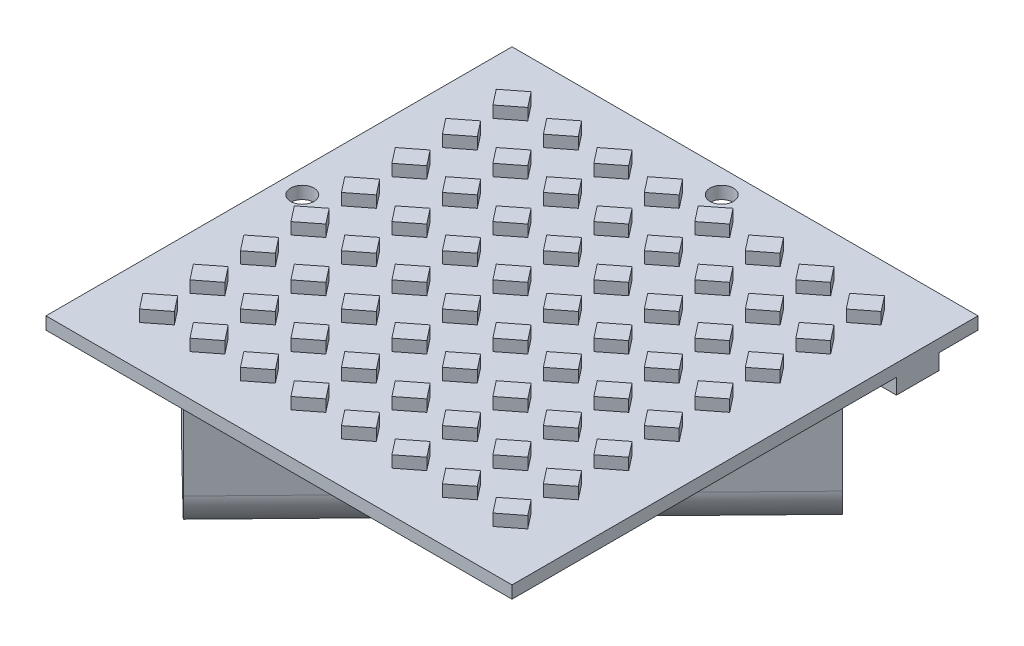
from build123d import *

# Parameters (mm, degrees)
SKETCH1_W           = 60
SKETCH1_H           = 60
BOSS_EXTRUDE1_DEPTH = 1.6
BOSS_EXTRUDE2_DEPTH = 1.5
BOSS_EXTRUDE3_DEPTH = 15
FILLET1_R           = 5
CUT_EXTRUDE1_REACH  = 52.757
SKETCH5_R           = 1.5
SKETCH6_W           = 20
SKETCH6_H           = 17
BOSS_EXTRUDE4_DEPTH = 3.2
SKETCH7_W           = 4
SKETCH7_H           = 5.5
BOSS_EXTRUDE5_DEPTH = 2


with BuildPart() as part:
    # Sketch1 → Boss-Extrude1 (new body)
    with BuildSketch(Plane(origin=(0, 0, 0), x_dir=(1, 0, 0), z_dir=(0, 1, 0))):
        with Locations((-5.537137766, -2.214696793)):
            Rectangle(SKETCH1_W, SKETCH1_H)
    extrude(amount=BOSS_EXTRUDE1_DEPTH)

    # Sketch2 → Boss-Extrude2 (add)
    with BuildSketch(Plane(origin=(0, 1.6, 0), x_dir=(1, 0, 0), z_dir=(0, 1, 0))):
        Polygon((-21.29585382, 22.505364141), (-19.756743715, 20.535303207), (-22.278421711, 18.565242273), (-23.817531816, 20.535303207), align=None)
        Polygon((-30.317531816, 20.535303207), (-27.79585382, 22.505364141), (-26.256743715, 20.535303207), (-28.778421711, 18.565242273), align=None)
        Polygon((-14.79585382, 22.505364141), (-13.256743715, 20.535303207), (-15.778421711, 18.565242273), (-17.317531816, 20.535303207), align=None)
        Polygon((-8.29585382, 22.505364141), (-6.756743715, 20.535303207), (-9.278421711, 18.565242273), (-10.817531816, 20.535303207), align=None)
        Polygon((-1.79585382, 22.505364141), (-0.256743715, 20.535303207), (-2.778421711, 18.565242273), (-4.317531816, 20.535303207), align=None)
        Polygon((4.70414618, 22.505364141), (6.243256285, 20.535303207), (3.721578289, 18.565242273), (2.182468184, 20.535303207), align=None)
        Polygon((11.20414618, 22.505364141), (12.743256285, 20.535303207), (10.221578289, 18.565242273), (8.682468184, 20.535303207), align=None)
        Polygon((17.70414618, 22.505364141), (19.243256285, 20.535303207), (16.721578289, 18.565242273), (15.182468184, 20.535303207), align=None)
        Polygon((-21.29585382, 16.005364141), (-19.756743715, 14.035303207), (-22.278421711, 12.065242273), (-23.817531816, 14.035303207), align=None)
        Polygon((-14.79585382, 16.005364141), (-13.256743715, 14.035303207), (-15.778421711, 12.065242273), (-17.317531816, 14.035303207), align=None)
        Polygon((-8.29585382, 16.005364141), (-6.756743715, 14.035303207), (-9.278421711, 12.065242273), (-10.817531816, 14.035303207), align=None)
        Polygon((-1.79585382, 16.005364141), (-0.256743715, 14.035303207), (-2.778421711, 12.065242273), (-4.317531816, 14.035303207), align=None)
        Polygon((4.70414618, 16.005364141), (6.243256285, 14.035303207), (3.721578289, 12.065242273), (2.182468184, 14.035303207), align=None)
        Polygon((11.20414618, 16.005364141), (12.743256285, 14.035303207), (10.221578289, 12.065242273), (8.682468184, 14.035303207), align=None)
        Polygon((17.70414618, 16.005364141), (19.243256285, 14.035303207), (16.721578289, 12.065242273), (15.182468184, 14.035303207), align=None)
        Polygon((-21.29585382, 9.505364141), (-19.756743715, 7.535303207), (-22.278421711, 5.565242273), (-23.817531816, 7.535303207), align=None)
        Polygon((-14.79585382, 9.505364141), (-13.256743715, 7.535303207), (-15.778421711, 5.565242273), (-17.317531816, 7.535303207), align=None)
        Polygon((-8.29585382, 9.505364141), (-6.756743715, 7.535303207), (-9.278421711, 5.565242273), (-10.817531816, 7.535303207), align=None)
        Polygon((-1.79585382, 9.505364141), (-0.256743715, 7.535303207), (-2.778421711, 5.565242273), (-4.317531816, 7.535303207), align=None)
        Polygon((4.70414618, 9.505364141), (6.243256285, 7.535303207), (3.721578289, 5.565242273), (2.182468184, 7.535303207), align=None)
        Polygon((11.20414618, 9.505364141), (12.743256285, 7.535303207), (10.221578289, 5.565242273), (8.682468184, 7.535303207), align=None)
        Polygon((17.70414618, 9.505364141), (19.243256285, 7.535303207), (16.721578289, 5.565242273), (15.182468184, 7.535303207), align=None)
        Polygon((-21.29585382, 3.005364141), (-19.756743715, 1.035303207), (-22.278421711, -0.934757727), (-23.817531816, 1.035303207), align=None)
        Polygon((-14.79585382, 3.005364141), (-13.256743715, 1.035303207), (-15.778421711, -0.934757727), (-17.317531816, 1.035303207), align=None)
        Polygon((-8.29585382, 3.005364141), (-6.756743715, 1.035303207), (-9.278421711, -0.934757727), (-10.817531816, 1.035303207), align=None)
        Polygon((-1.79585382, 3.005364141), (-0.256743715, 1.035303207), (-2.778421711, -0.934757727), (-4.317531816, 1.035303207), align=None)
        Polygon((4.70414618, 3.005364141), (6.243256285, 1.035303207), (3.721578289, -0.934757727), (2.182468184, 1.035303207), align=None)
        Polygon((11.20414618, 3.005364141), (12.743256285, 1.035303207), (10.221578289, -0.934757727), (8.682468184, 1.035303207), align=None)
        Polygon((17.70414618, 3.005364141), (19.243256285, 1.035303207), (16.721578289, -0.934757727), (15.182468184, 1.035303207), align=None)
        Polygon((-21.29585382, -3.494635859), (-19.756743715, -5.464696793), (-22.278421711, -7.434757727), (-23.817531816, -5.464696793), align=None)
        Polygon((-14.79585382, -3.494635859), (-13.256743715, -5.464696793), (-15.778421711, -7.434757727), (-17.317531816, -5.464696793), align=None)
        Polygon((-8.29585382, -3.494635859), (-6.756743715, -5.464696793), (-9.278421711, -7.434757727), (-10.817531816, -5.464696793), align=None)
        Polygon((-1.79585382, -3.494635859), (-0.256743715, -5.464696793), (-2.778421711, -7.434757727), (-4.317531816, -5.464696793), align=None)
        Polygon((4.70414618, -3.494635859), (6.243256285, -5.464696793), (3.721578289, -7.434757727), (2.182468184, -5.464696793), align=None)
        Polygon((11.20414618, -3.494635859), (12.743256285, -5.464696793), (10.221578289, -7.434757727), (8.682468184, -5.464696793), align=None)
        Polygon((17.70414618, -3.494635859), (19.243256285, -5.464696793), (16.721578289, -7.434757727), (15.182468184, -5.464696793), align=None)
        Polygon((-21.29585382, -9.994635859), (-19.756743715, -11.964696793), (-22.278421711, -13.934757727), (-23.817531816, -11.964696793), align=None)
        Polygon((-14.79585382, -9.994635859), (-13.256743715, -11.964696793), (-15.778421711, -13.934757727), (-17.317531816, -11.964696793), align=None)
        Polygon((-8.29585382, -9.994635859), (-6.756743715, -11.964696793), (-9.278421711, -13.934757727), (-10.817531816, -11.964696793), align=None)
        Polygon((-1.79585382, -9.994635859), (-0.256743715, -11.964696793), (-2.778421711, -13.934757727), (-4.317531816, -11.964696793), align=None)
        Polygon((4.70414618, -9.994635859), (6.243256285, -11.964696793), (3.721578289, -13.934757727), (2.182468184, -11.964696793), align=None)
        Polygon((11.20414618, -9.994635859), (12.743256285, -11.964696793), (10.221578289, -13.934757727), (8.682468184, -11.964696793), align=None)
        Polygon((17.70414618, -9.994635859), (19.243256285, -11.964696793), (16.721578289, -13.934757727), (15.182468184, -11.964696793), align=None)
        Polygon((-21.29585382, -16.494635859), (-19.756743715, -18.464696793), (-22.278421711, -20.434757727), (-23.817531816, -18.464696793), align=None)
        Polygon((-14.79585382, -16.494635859), (-13.256743715, -18.464696793), (-15.778421711, -20.434757727), (-17.317531816, -18.464696793), align=None)
        Polygon((-8.29585382, -16.494635859), (-6.756743715, -18.464696793), (-9.278421711, -20.434757727), (-10.817531816, -18.464696793), align=None)
        Polygon((-1.79585382, -16.494635859), (-0.256743715, -18.464696793), (-2.778421711, -20.434757727), (-4.317531816, -18.464696793), align=None)
        Polygon((4.70414618, -16.494635859), (6.243256285, -18.464696793), (3.721578289, -20.434757727), (2.182468184, -18.464696793), align=None)
        Polygon((11.20414618, -16.494635859), (12.743256285, -18.464696793), (10.221578289, -20.434757727), (8.682468184, -18.464696793), align=None)
        Polygon((17.70414618, -16.494635859), (19.243256285, -18.464696793), (16.721578289, -20.434757727), (15.182468184, -18.464696793), align=None)
        Polygon((-21.29585382, -22.994635859), (-19.756743715, -24.964696793), (-22.278421711, -26.934757727), (-23.817531816, -24.964696793), align=None)
        Polygon((-14.79585382, -22.994635859), (-13.256743715, -24.964696793), (-15.778421711, -26.934757727), (-17.317531816, -24.964696793), align=None)
        Polygon((-8.29585382, -22.994635859), (-6.756743715, -24.964696793), (-9.278421711, -26.934757727), (-10.817531816, -24.964696793), align=None)
        Polygon((-1.79585382, -22.994635859), (-0.256743715, -24.964696793), (-2.778421711, -26.934757727), (-4.317531816, -24.964696793), align=None)
        Polygon((4.70414618, -22.994635859), (6.243256285, -24.964696793), (3.721578289, -26.934757727), (2.182468184, -24.964696793), align=None)
        Polygon((11.20414618, -22.994635859), (12.743256285, -24.964696793), (10.221578289, -26.934757727), (8.682468184, -24.964696793), align=None)
        Polygon((17.70414618, -22.994635859), (19.243256285, -24.964696793), (16.721578289, -26.934757727), (15.182468184, -24.964696793), align=None)
        Polygon((-27.79585382, 16.005364141), (-26.256743715, 14.035303207), (-28.778421711, 12.065242273), (-30.317531816, 14.035303207), align=None)
        Polygon((-27.79585382, 9.505364141), (-26.256743715, 7.535303207), (-28.778421711, 5.565242273), (-30.317531816, 7.535303207), align=None)
        Polygon((-27.79585382, 3.005364141), (-26.256743715, 1.035303207), (-28.778421711, -0.934757727), (-30.317531816, 1.035303207), align=None)
        Polygon((-27.79585382, -3.494635859), (-26.256743715, -5.464696793), (-28.778421711, -7.434757727), (-30.317531816, -5.464696793), align=None)
        Polygon((-27.79585382, -9.994635859), (-26.256743715, -11.964696793), (-28.778421711, -13.934757727), (-30.317531816, -11.964696793), align=None)
        Polygon((-27.79585382, -16.494635859), (-26.256743715, -18.464696793), (-28.778421711, -20.434757727), (-30.317531816, -18.464696793), align=None)
        Polygon((-27.79585382, -22.994635859), (-26.256743715, -24.964696793), (-28.778421711, -26.934757727), (-30.317531816, -24.964696793), align=None)
    extrude(amount=BOSS_EXTRUDE2_DEPTH)

    # Sketch4 → Boss-Extrude3 (add)
    with BuildSketch(Plane.XZ):
        Polygon((11.879038619, -22.640640423), (23.696643731, -11.125684522), (-18.175923183, 31.847424977), (-29.993528295, 20.332469076), align=None)
    extrude(amount=BOSS_EXTRUDE3_DEPTH)

    # Fillet1
    fillet1_edges = [part.edges().sort_by_distance(p)[0] for p in [
        (2.760360274, -15, 10.360870227),
        (-9.057244838, -15, -1.154085674),
    ]]
    fillet(fillet1_edges, radius=FILLET1_R)

    # Sketch5 → Cut-Extrude1 (cut, up to next)
    with BuildSketch(Plane(origin=(0, 1.6, 0), x_dir=(1, 0, 0), z_dir=(0, 1, 0)), mode=Mode.PRIVATE) as cut_extrude1_sk1:
        with Locations((-32.537137766, -2.214696793)):
            Circle(SKETCH5_R)
    cut_extrude1_tool1 = extrude(cut_extrude1_sk1.sketch, amount=-CUT_EXTRUDE1_REACH, mode=Mode.PRIVATE) & part.part
    # Sketch5 → Cut-Extrude1 (cut, up to next)
    with BuildSketch(Plane(origin=(0, 1.6, 0), x_dir=(1, 0, 0), z_dir=(0, 1, 0)), mode=Mode.PRIVATE) as cut_extrude1_sk2:
        with Locations((-5.537137766, 24.785303207)):
            Circle(SKETCH5_R)
    cut_extrude1_tool2 = extrude(cut_extrude1_sk2.sketch, amount=-CUT_EXTRUDE1_REACH, mode=Mode.PRIVATE) & part.part
    add(cut_extrude1_tool1.solids().sort_by_distance((-32.537138, 1.6, 2.214697))[0], mode=Mode.SUBTRACT)
    add(cut_extrude1_tool2.solids().sort_by_distance((-5.537138, 1.6, -24.785303))[0], mode=Mode.SUBTRACT)

    # Sketch6 → Boss-Extrude4 (add)
    with BuildSketch(Plane.XZ):
        with Locations((-22.884232904, -12.709224584)):
            Rectangle(SKETCH6_W, SKETCH6_H)
    extrude(amount=BOSS_EXTRUDE4_DEPTH)

    # Sketch7 → Boss-Extrude5 (add)
    with BuildSketch(Plane.XZ):
        with Locations((22.462862234, -20.035303207)):
            Rectangle(SKETCH7_W, SKETCH7_H)
    extrude(amount=BOSS_EXTRUDE5_DEPTH)


solid = part.part
